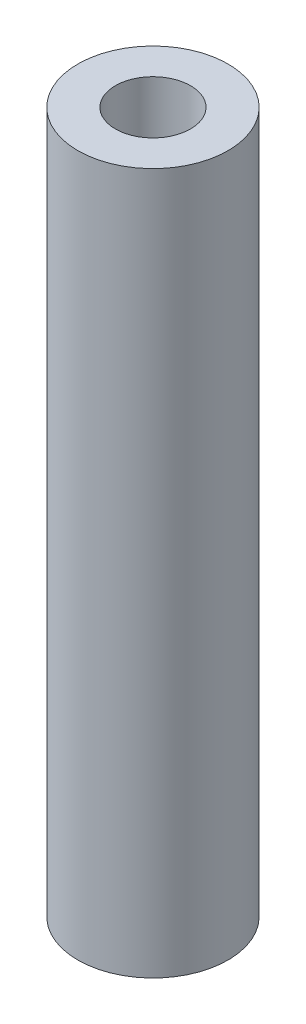
from build123d import *

# Parameters (mm, degrees)
SKETCH2_R           = 3
SKETCH2_R_2         = 1.5
BOSS_EXTRUDE1_DEPTH = 28


with BuildPart() as part:
    # Sketch2 → Boss-Extrude1 (new body)
    with BuildSketch(Plane(origin=(0, 0, 0), x_dir=(1, 0, 0), z_dir=(0, 1, 0))):
        with Locations((-15.084082691, 6.46581124)):
            Circle(SKETCH2_R)
        with Locations((-15.084082691, 6.46581124)):
            Circle(SKETCH2_R_2, mode=Mode.SUBTRACT)
    extrude(amount=BOSS_EXTRUDE1_DEPTH)


solid = part.part
